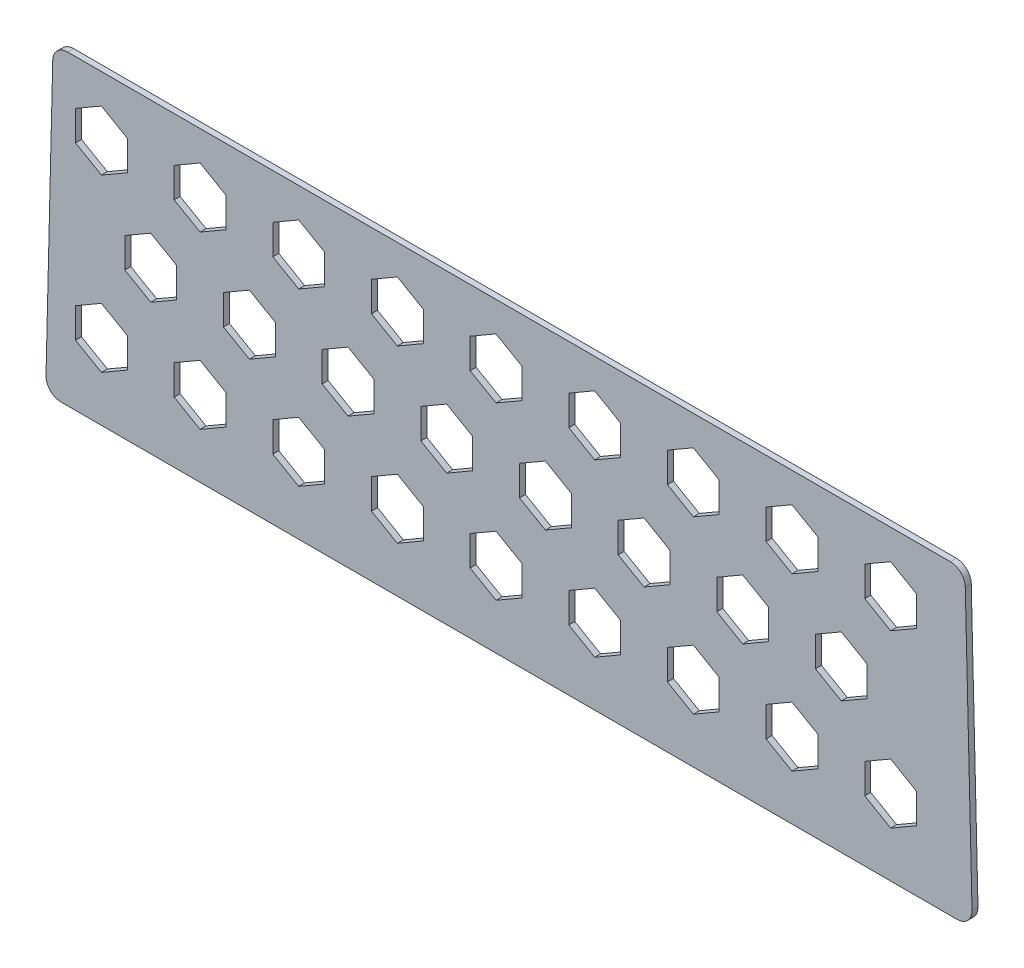
from build123d import *

# Parameters (mm, degrees)
BOSS_EXTRUDE1_DEPTH = 2.54
FILLET1_R           = 6.35
CUT_EXTRUDE2_DEPTH  = 208.198123426
FILL_PATTERN1_DEPTH = 2.54


# Read off the part's stored shape, not the designer's step: Fill Pattern1
with BuildPart() as part:
    # Sketch1 → Boss-Extrude1 (new body)
    with BuildSketch(Plane.XY):
        Polygon((-193.675, 65.0875), (-196.85, -65.0875), (196.85, -65.0875), (193.675, 65.0875), align=None)
    extrude(amount=BOSS_EXTRUDE1_DEPTH)

    # Fillet1
    fillet1_edges = [part.edges().sort_by_distance(p)[0] for p in [
        (-196.85, -65.0875, 1.27),
        (-193.675, 65.0875, 1.27),
        (193.675, 65.0875, 1.27),
        (196.85, -65.0875, 1.27),
    ]]
    fillet(fillet1_edges, radius=FILLET1_R)

    # Sketch3 → Cut-Extrude2 (cut, through all)
    with BuildSketch(Plane.XY.offset(2.54)):
        Polygon((-162.152954744, 33.3375), (-162.152954744, 46.0375), (-173.151477372, 52.3875), (-184.15, 46.0375), (-184.15, 33.3375), (-173.151477372, 26.9875), align=None)
    extrude(amount=-CUT_EXTRUDE2_DEPTH, mode=Mode.SUBTRACT)

    # Fill Pattern1 outline → Fill Pattern1 (cut)
    with BuildSketch(Plane.XY):
        Polygon((-36.422954744, -39.252749345), (-36.422954744, -26.552749345), (-47.421477372, -20.202749345), (-58.42, -26.552749345), (-58.42, -39.252749345), (-47.421477372, -45.602749345), align=None)
        Polygon((-99.287954744, -2.957624673), (-99.287954744, 9.742375327), (-110.286477372, 16.092375327), (-121.285, 9.742375327), (-121.285, -2.957624673), (-110.286477372, -9.307624673), align=None)
        Polygon((-173.151477372, -45.602749345), (-162.152954744, -39.252749345), (-162.152954744, -26.552749345), (-173.151477372, -20.202749345), (-184.15, -26.552749345), (-184.15, -39.252749345), align=None)
        Polygon((173.127045256, -39.252749345), (173.127045256, -26.552749345), (162.128522628, -20.202749345), (151.13, -26.552749345), (151.13, -39.252749345), (162.128522628, -45.602749345), align=None)
        Polygon((110.262045256, -2.957624673), (110.262045256, 9.742375327), (99.263522628, 16.092375327), (88.265, 9.742375327), (88.265, -2.957624673), (99.263522628, -9.307624673), align=None)
        Polygon((47.397045256, 33.3375), (47.397045256, 46.0375), (36.398522628, 52.3875), (25.4, 46.0375), (25.4, 33.3375), (36.398522628, 26.9875), align=None)
        Polygon((162.128522628, 26.9875), (173.127045256, 33.3375), (173.127045256, 46.0375), (162.128522628, 52.3875), (151.13, 46.0375), (151.13, 33.3375), align=None)
        Polygon((25.4, -39.252749345), (36.398522628, -45.602749345), (47.397045256, -39.252749345), (47.397045256, -26.552749345), (36.398522628, -20.202749345), (25.4, -26.552749345), align=None)
        Polygon((152.172045256, -2.957624673), (152.172045256, 9.742375327), (141.173522628, 16.092375327), (130.175, 9.742375327), (130.175, -2.957624673), (141.173522628, -9.307624673), align=None)
        Polygon((89.307045256, 33.3375), (89.307045256, 46.0375), (78.308522628, 52.3875), (67.31, 46.0375), (67.31, 33.3375), (78.308522628, 26.9875), align=None)
        Polygon((67.31, -39.252749345), (78.308522628, -45.602749345), (89.307045256, -39.252749345), (89.307045256, -26.552749345), (78.308522628, -20.202749345), (67.31, -26.552749345), align=None)
        Polygon((131.217045256, -39.252749345), (131.217045256, -26.552749345), (120.218522628, -20.202749345), (109.22, -26.552749345), (109.22, -39.252749345), (120.218522628, -45.602749345), align=None)
        Polygon((68.352045256, -2.957624673), (68.352045256, 9.742375327), (57.353522628, 16.092375327), (46.355, 9.742375327), (46.355, -2.957624673), (57.353522628, -9.307624673), align=None)
        Polygon((5.487045256, 33.3375), (5.487045256, 46.0375), (-5.511477372, 52.3875), (-16.51, 46.0375), (-16.51, 33.3375), (-5.511477372, 26.9875), align=None)
        Polygon((120.218522628, 26.9875), (131.217045256, 33.3375), (131.217045256, 46.0375), (120.218522628, 52.3875), (109.22, 46.0375), (109.22, 33.3375), align=None)
        Polygon((-16.51, -39.252749345), (-5.511477372, -45.602749345), (5.487045256, -39.252749345), (5.487045256, -26.552749345), (-5.511477372, -20.202749345), (-16.51, -26.552749345), align=None)
        Polygon((26.442045256, -2.957624673), (26.442045256, 9.742375327), (15.443522628, 16.092375327), (4.445, 9.742375327), (4.445, -2.957624673), (15.443522628, -9.307624673), align=None)
        Polygon((-36.422954744, 33.3375), (-36.422954744, 46.0375), (-47.421477372, 52.3875), (-58.42, 46.0375), (-58.42, 33.3375), (-47.421477372, 26.9875), align=None)
        Polygon((-15.467954744, -2.957624673), (-15.467954744, 9.742375327), (-26.466477372, 16.092375327), (-37.465, 9.742375327), (-37.465, -2.957624673), (-26.466477372, -9.307624673), align=None)
        Polygon((-78.332954744, 33.3375), (-78.332954744, 46.0375), (-89.331477372, 52.3875), (-100.33, 46.0375), (-100.33, 33.3375), (-89.331477372, 26.9875), align=None)
        Polygon((-100.33, -39.252749345), (-89.331477372, -45.602749345), (-78.332954744, -39.252749345), (-78.332954744, -26.552749345), (-89.331477372, -20.202749345), (-100.33, -26.552749345), align=None)
        Polygon((-57.377954744, -2.957624673), (-57.377954744, 9.742375327), (-68.376477372, 16.092375327), (-79.375, 9.742375327), (-79.375, -2.957624673), (-68.376477372, -9.307624673), align=None)
        Polygon((-120.242954744, 33.3375), (-120.242954744, 46.0375), (-131.241477372, 52.3875), (-142.24, 46.0375), (-142.24, 33.3375), (-131.241477372, 26.9875), align=None)
        Polygon((-142.24, -39.252749345), (-131.241477372, -45.602749345), (-120.242954744, -39.252749345), (-120.242954744, -26.552749345), (-131.241477372, -20.202749345), (-142.24, -26.552749345), align=None)
        Polygon((-141.197954744, -2.957624673), (-141.197954744, 9.742375327), (-152.196477372, 16.092375327), (-163.195, 9.742375327), (-163.195, -2.957624673), (-152.196477372, -9.307624673), align=None)
    extrude(amount=FILL_PATTERN1_DEPTH, mode=Mode.SUBTRACT)


solid = part.part
